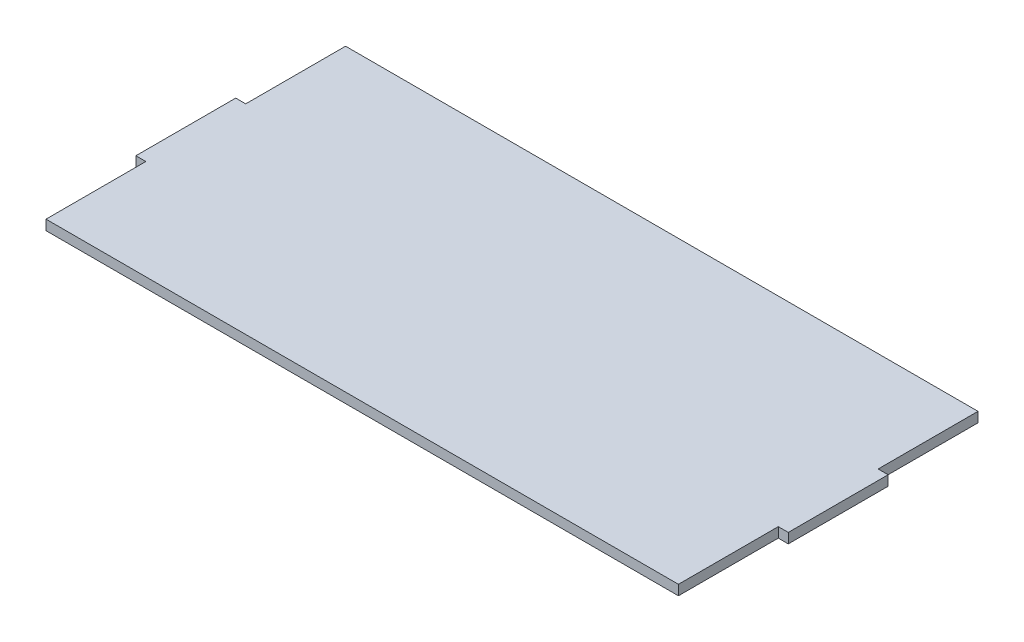
from build123d import *

# Parameters (mm, degrees)
BOSS_EXTRUDE1_DEPTH = 3


with BuildPart() as part:
    # Sketch1 → Boss-Extrude1 (new body)
    with BuildSketch(Plane(origin=(0, 0, 0), x_dir=(1, 0, 0), z_dir=(0, 1, 0))):
        Polygon((-95, 15), (-98, 15), (-98, -15), (-95, -15), (-95, -45), (95, -45), (95, -15), (98, -15), (98, 15), (95, 15), (95, 45), (-95, 45), align=None)
    extrude(amount=BOSS_EXTRUDE1_DEPTH)


solid = part.part
